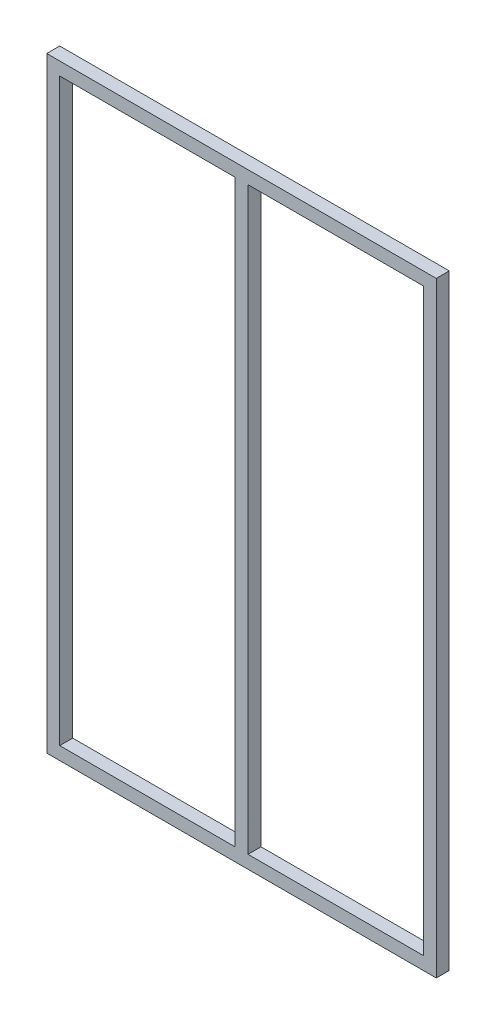
from build123d import *

# Parameters (mm, degrees)
SKETCH1_W           = 571.5
SKETCH1_H           = 889
BOSS_EXTRUDE1_DEPTH = 19.05
SKETCH2_W           = 257.175
SKETCH2_H           = 850.9
CUT_EXTRUDE1_DEPTH  = 529.768583598


with BuildPart() as part:
    # Sketch1 → Boss-Extrude1 (new body)
    with BuildSketch(Plane.XY):
        Rectangle(SKETCH1_W, SKETCH1_H)
    extrude(amount=-BOSS_EXTRUDE1_DEPTH)

    # Sketch2 → Cut-Extrude1 (cut, through all)
    with BuildSketch(Plane.XY):
        with Locations((-138.1125, 0)):
            Rectangle(SKETCH2_W, SKETCH2_H)
        with Locations((138.1125, 0)):
            Rectangle(SKETCH2_W, SKETCH2_H)
    extrude(amount=-CUT_EXTRUDE1_DEPTH, mode=Mode.SUBTRACT)


solid = part.part
